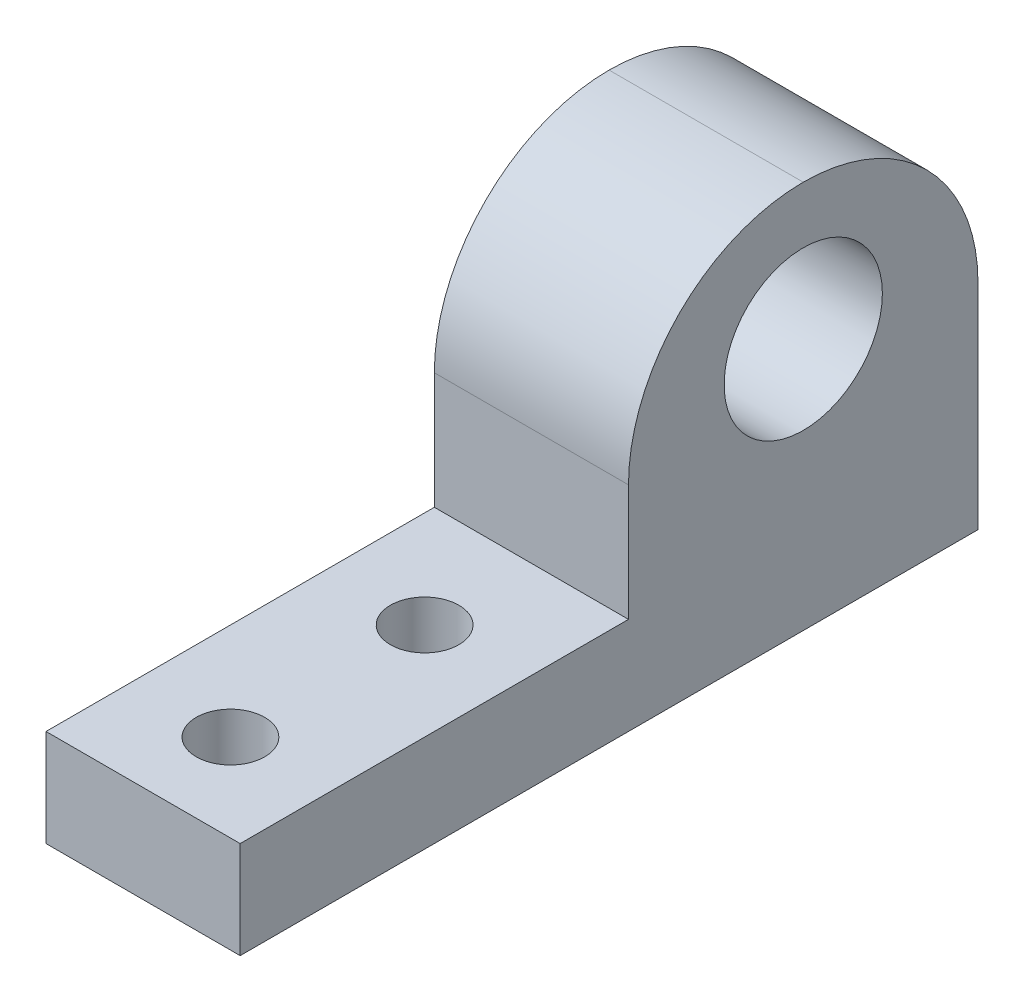
from build123d import *

# Parameters (mm, degrees)
SKETCH_2_W          = 10
SKETCH_2_H          = 38
SKETCH_2_R          = 1.763596052
EXTRUDE_2_DEPTH     = 5
SKETCH_3_W          = 10
SKETCH_3_H          = 18
EXTRUDE_3_DEPTH     = 15
FILLET_1_R          = 9
SKETCH_4_R          = 4.075
CUT_EXTRUDE_1_DEPTH = 20


with BuildPart() as part:
    # 草图2 → 凸台-拉伸2 (new body)
    with BuildSketch(Plane(origin=(0, 0, 0), x_dir=(1, 0, 0), z_dir=(0, 1, 0))):
        with Locations((-2.189189189, -12.405405405)):
            Rectangle(SKETCH_2_W, SKETCH_2_H)
        with Locations(Location((-2.189189189, -26.905405405, 0), (0, 0, 270))):
            Circle(SKETCH_2_R, mode=Mode.SUBTRACT)
        with Locations(Location((-2.189189189, -16.905405405, 0), (0, 0, 270))):
            Circle(SKETCH_2_R, mode=Mode.SUBTRACT)
    extrude(amount=EXTRUDE_2_DEPTH)

    # 草图3 → 凸台-拉伸3 (add)
    with BuildSketch(Plane(origin=(0, 5, 0), x_dir=(1, 0, 0), z_dir=(0, 1, 0))):
        with Locations((-2.189189189, -2.405405405)):
            Rectangle(SKETCH_3_W, SKETCH_3_H)
    extrude(amount=EXTRUDE_3_DEPTH)

    # 圆角1
    fillet_1_edges = [part.edges().sort_by_distance(p)[0] for p in [
        (-2.189189189, 20, 11.405405405),
        (-2.189189189, 20, -6.594594595),
    ]]
    fillet(fillet_1_edges, radius=FILLET_1_R - 0.0001)  # a hair under: the kernel refuses the full size

    # 草图4 → 切除-拉伸1 (cut)
    with BuildSketch(Plane(origin=(2.810810811, 0, 0), x_dir=(0, 0, -1), z_dir=(1, 0, 0))):
        with Locations((-2.405405405, 13)):
            Circle(SKETCH_4_R)
    extrude(amount=-CUT_EXTRUDE_1_DEPTH, mode=Mode.SUBTRACT)


solid = part.part
